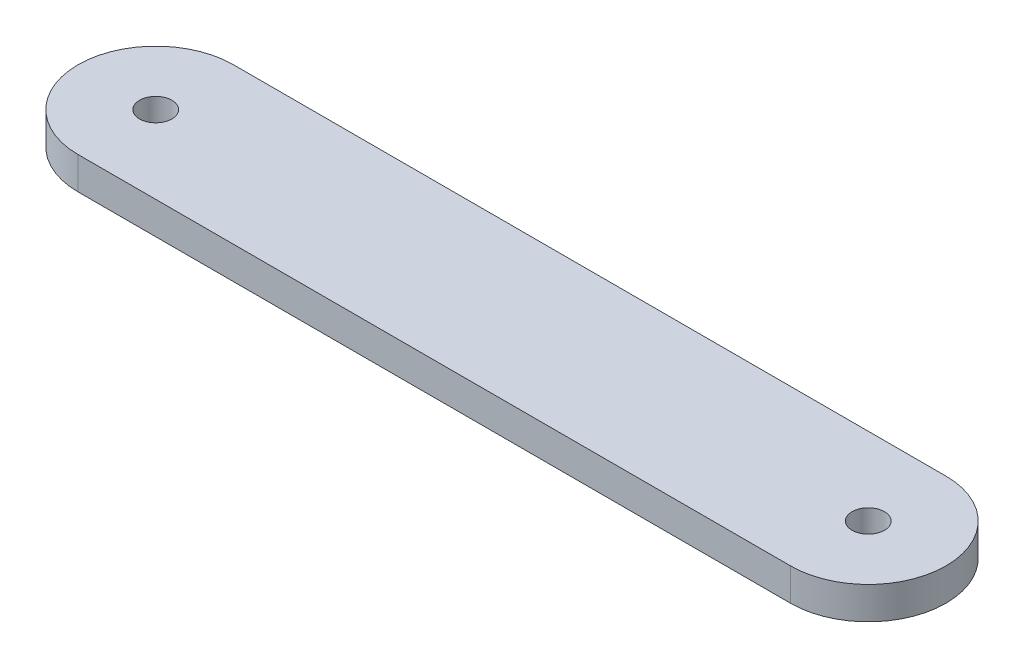
from build123d import *

# Parameters (mm, degrees)
SKETCH_1_R      = 2.5
EXTRUDE_1_DEPTH = 5


with BuildPart() as part:
    # Эскиз1 → Вытянуть1 (new body)
    with BuildSketch(Plane(origin=(0, 0, 0), x_dir=(1, 0, 0), z_dir=(0, 1, 0))):
        with BuildLine():
            Line((0, 10.177767955), (110, 10.177767955))
            ThreePointArc((110, 10.177767955), (122, -1.822232045), (110, -13.822232045))
            Line((110, -13.822232045), (0, -13.822232045))
            ThreePointArc((0, -13.822232045), (-12, -1.822232045), (0, 10.177767955))
        make_face()
        with Locations((0, -1.822232045)):
            Circle(SKETCH_1_R, mode=Mode.SUBTRACT)
        with Locations((110, -1.822232045)):
            Circle(SKETCH_1_R, mode=Mode.SUBTRACT)
    extrude(amount=EXTRUDE_1_DEPTH)


solid = part.part
